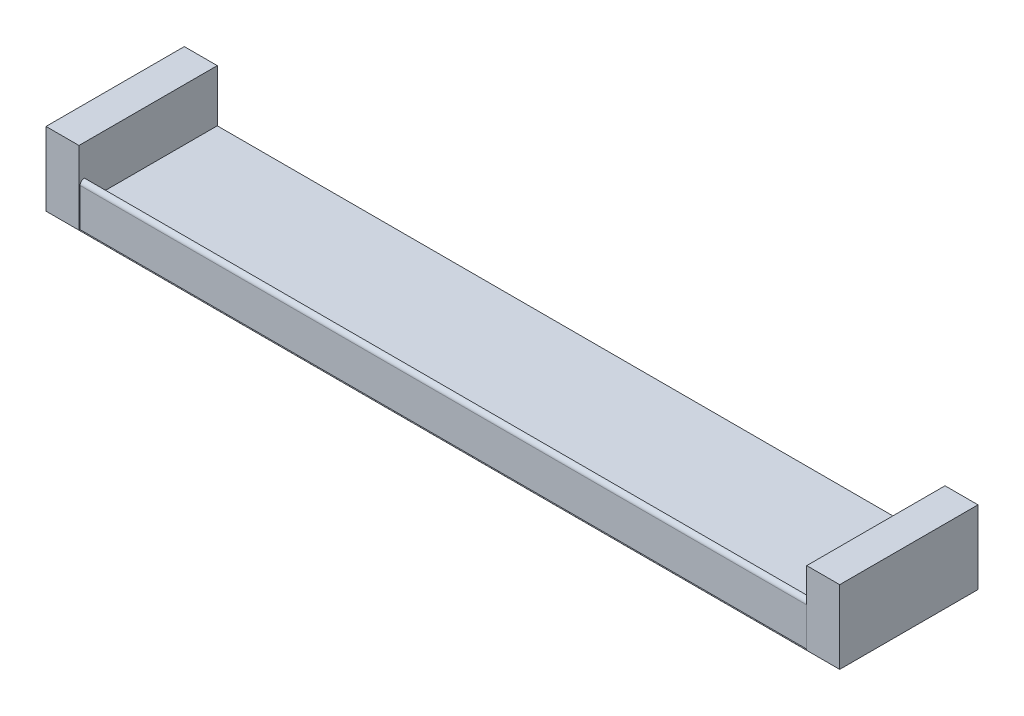
from build123d import *

# Parameters (mm, degrees)
CROQUIS2_W              = 31
CROQUIS2_H              = 130
SALIENTE_EXTRUIR1_DEPTH = 69
CROQUIS3_W              = 130
CROQUIS3_H              = 40
SALIENTE_EXTRUIR2_DEPTH = 715
CROQUIS4_W              = 31
CROQUIS4_H              = 130
SALIENTE_EXTRUIR3_DEPTH = 29
CROQUIS7_W              = 684
CROQUIS7_H              = 20
CORTAR_EXTRUIR2_DEPTH   = 125
CROQUIS8_W              = 684
CROQUIS8_H              = 39.960038326
CORTAR_EXTRUIR3_DEPTH   = 1
REDONDEO1_R             = 4


with BuildPart() as part:
    # Croquis2 → Saliente-Extruir1 (new body)
    with BuildSketch(Plane(origin=(0, 0, 0), x_dir=(1, 0, 0), z_dir=(0, 1, 0))):
        with Locations((15.5, 65)):
            Rectangle(CROQUIS2_W, CROQUIS2_H)
    extrude(amount=SALIENTE_EXTRUIR1_DEPTH)

    # Croquis3 → Saliente-Extruir2 (add)
    with BuildSketch(Plane(origin=(31, 0, 0), x_dir=(0, 0, -1), z_dir=(1, 0, 0))):
        with Locations((65, 20)):
            Rectangle(CROQUIS3_W, CROQUIS3_H)
    extrude(amount=SALIENTE_EXTRUIR2_DEPTH)

    # Croquis4 → Saliente-Extruir3 (add)
    with BuildSketch(Plane(origin=(0, 40, 0), x_dir=(1, 0, 0), z_dir=(0, 1, 0))):
        with Locations((730.5, 65)):
            Rectangle(CROQUIS4_W, CROQUIS4_H)
    extrude(amount=SALIENTE_EXTRUIR3_DEPTH)

    # Croquis7 → Cortar-Extruir2 (cut)
    with BuildSketch(Plane(origin=(0, 0, -130), x_dir=(-1, 0, 0), z_dir=(0, 0, -1))):
        with Locations((-373, 30)):
            Rectangle(CROQUIS7_W, CROQUIS7_H)
    extrude(amount=-CORTAR_EXTRUIR2_DEPTH, mode=Mode.SUBTRACT)

    # Croquis8 → Cortar-Extruir3 (cut)
    with BuildSketch(Plane.XY):
        with Locations((373, 20.019980837)):
            Rectangle(CROQUIS8_W, CROQUIS8_H)
    extrude(amount=-CORTAR_EXTRUIR3_DEPTH, mode=Mode.SUBTRACT)

    # Redondeo1
    redondeo1_edges = [part.edges().sort_by_distance(p)[0] for p in [
        (373, 40, -1),
    ]]
    fillet(redondeo1_edges, radius=REDONDEO1_R - 0.0001)  # a hair under: the kernel refuses the full size


solid = part.part
